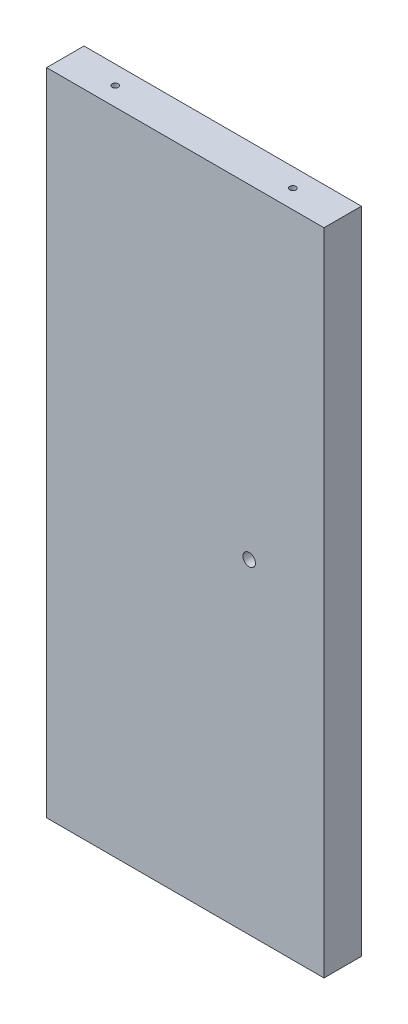
from build123d import *

# Parameters (mm, degrees)
SKETCH1_W                   = 141.287862113
SKETCH1_H                   = 330.949999988
BOSS_EXTRUDE1_DEPTH         = 19.05
HOLE1_D                     = 3.175
HOLE1_DEPTH                 = 31.75
HOLE1_CSINK_D               = 10.16
HOLE1_CSINK_ANGLE           = 82
HOLE1_TIP                   = 0.953866233
HOLE3_D                     = 3.175
HOLE3_DEPTH                 = 38.1
HOLE3_CSINK_D               = 10.16
HOLE3_CSINK_ANGLE           = 82
HOLE3_TIP                   = 0.953866233
F_1_4_0_25_DIAMETER_HOLE1_D = 6.35
HOLE4_D                     = 3.175
HOLE4_DEPTH                 = 31.75
HOLE4_CSINK_D               = 10.16
HOLE4_CSINK_ANGLE           = 82
HOLE4_TIP                   = 0.953866233
HOLE5_D                     = 3.175
HOLE5_DEPTH                 = 38.1
HOLE5_CSINK_D               = 10.16
HOLE5_CSINK_ANGLE           = 82
HOLE5_TIP                   = 0.953866233


with BuildPart() as part:
    # Sketch1 → Boss-Extrude1 (new body)
    with BuildSketch(Plane.XY):
        with Locations((279.996898238, -72.024999997)):
            Rectangle(SKETCH1_W, SKETCH1_H)
    extrude(amount=BOSS_EXTRUDE1_DEPTH)

    # Hole1
    with Locations(Plane(origin=(196.652967181, -72.024999997, 386.262770337), x_dir=(0, 1, 0), z_dir=(-1, 0, 0))):
        with Locations((174.999999994, 685.961004241), (174.999999994, 549.837259632), (174.999999994, 413.713515022), (81.549999997, 779.649723129), (81.549999997, 652.344645962), (62.499999997, 662.953402392), (62.499999997, 769.040966698), (-62.499999997, 769.040966698), (-62.499999997, 662.953402392), (-81.549999997, 652.344645962), (-81.549999997, 779.649723129), (-174.999999994, 413.713515022), (-174.999999994, 549.837259632), (-174.999999994, 685.961004241), (-82.737499997, 600.384620239), (0, 600.384620239), (82.737499997, 600.384620239), (0, 376.737770337), (-82.737499997, 376.737770337), (82.737499997, 376.737770337)):
            CounterSinkHole(HOLE1_D / 2, HOLE1_CSINK_D / 2, depth=HOLE1_DEPTH, counter_sink_angle=HOLE1_CSINK_ANGLE)
            with Locations((0, 0, -(HOLE1_DEPTH + HOLE1_TIP / 2))):  # 118° drill point
                Cone(0, HOLE1_D / 2, HOLE1_TIP, mode=Mode.SUBTRACT)

    # Hole3
    with Locations(Plane(origin=(-181.039434513, 112.499999997, 386.262770337), x_dir=(0.9271838545667855, -1.3196841813264566e-15, -0.37460659341591657), z_dir=(0, 1, 0))):
        with Locations((46.221112845, 113.488854888), (39.39759596, 37.945520226), (412.28786892, 80.423559293), (407.308516105, 25.297013484), (513.561319184, 161.164706775), (597.46020397, 127.267357003), (610.543339245, 159.649253123), (694.322923815, 367.011001477), (526.644454459, 193.546602895), (610.424039029, 400.908351249)):
            CounterSinkHole(HOLE3_D / 2, HOLE3_CSINK_D / 2, depth=HOLE3_DEPTH, counter_sink_angle=HOLE3_CSINK_ANGLE)
            with Locations((0, 0, -(HOLE3_DEPTH + HOLE3_TIP / 2))):  # 118° drill point
                Cone(0, HOLE3_D / 2, HOLE3_TIP, mode=Mode.SUBTRACT)

    # 1/4 (0.25) Diameter Hole1 (through all)
    with Locations(Plane(origin=(0, 0, 0), x_dir=(-1, 0, 0), z_dir=(0, 0, -1))):
        with Locations((-312.540829294, -72.024999997)):
            Hole(F_1_4_0_25_DIAMETER_HOLE1_D / 2)

    # Hole4
    with Locations(Plane(origin=(196.652967181, -72.024999997, 609.909620239), x_dir=(0, 1, 0), z_dir=(-1, 0, 0))):
        with Locations((174.999999994, 685.961004241), (174.999999994, 549.837259632), (174.999999994, 413.713515022), (81.549999997, 779.649723129), (81.549999997, 652.344645962), (62.499999997, 662.953402392), (62.499999997, 769.040966698), (-62.499999997, 769.040966698), (-62.499999997, 662.953402392), (-81.549999997, 652.344645962), (-81.549999997, 779.649723129), (-174.999999994, 413.713515022), (-174.999999994, 549.837259632), (-174.999999994, 685.961004241), (-82.737499997, 600.384620239), (0, 600.384620239), (82.737499997, 600.384620239), (0, 376.737770337), (-82.737499997, 376.737770337), (82.737499997, 376.737770337)):
            CounterSinkHole(HOLE4_D / 2, HOLE4_CSINK_D / 2, depth=HOLE4_DEPTH, counter_sink_angle=HOLE4_CSINK_ANGLE)
            with Locations((0, 0, -(HOLE4_DEPTH + HOLE4_TIP / 2))):  # 118° drill point
                Cone(0, HOLE4_D / 2, HOLE4_TIP, mode=Mode.SUBTRACT)

    # Hole5
    with Locations(Plane(origin=(-181.039434513, 112.499999997, 609.909620239), x_dir=(0.9271838545667913, -6.190403823971236e-15, -0.3746065934159023), z_dir=(0, 1, 0))):
        with Locations((46.221112845, 113.488854888), (39.39759596, 37.945520226), (412.28786892, 80.423559293), (407.308516105, 25.297013484), (513.561319184, 161.164706775), (597.46020397, 127.267357003), (610.543339245, 159.649253123), (694.322923815, 367.011001477), (526.644454459, 193.546602895), (610.424039029, 400.908351249)):
            CounterSinkHole(HOLE5_D / 2, HOLE5_CSINK_D / 2, depth=HOLE5_DEPTH, counter_sink_angle=HOLE5_CSINK_ANGLE)
            with Locations((0, 0, -(HOLE5_DEPTH + HOLE5_TIP / 2))):  # 118° drill point
                Cone(0, HOLE5_D / 2, HOLE5_TIP, mode=Mode.SUBTRACT)


solid = part.part
